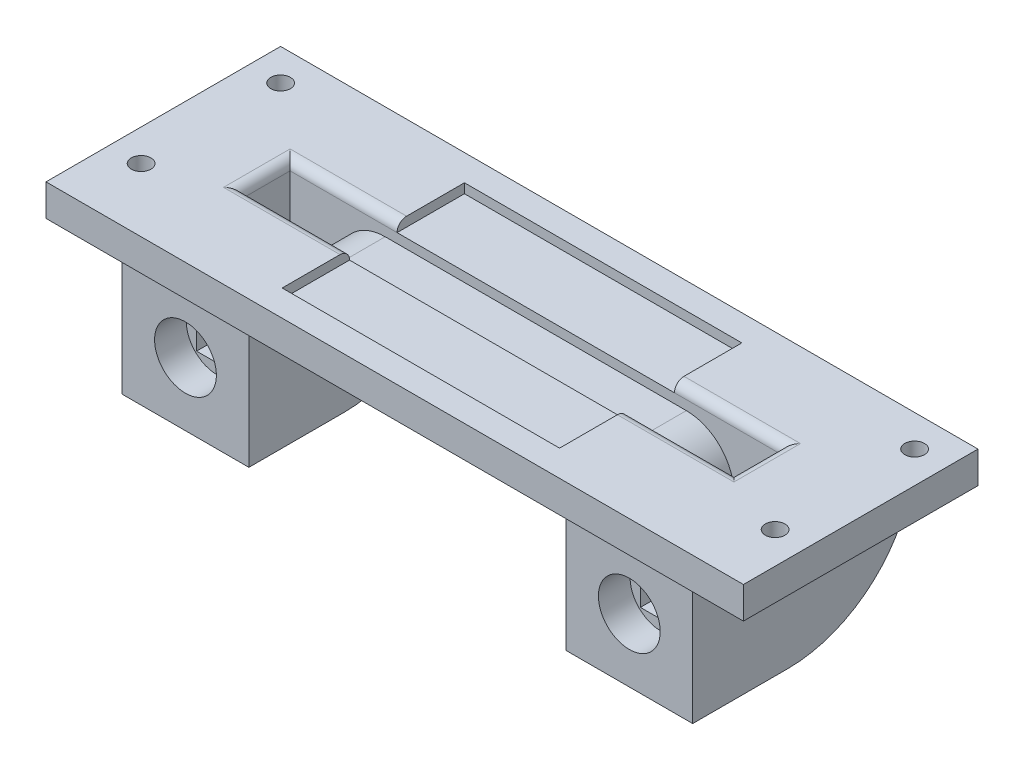
from build123d import *

# Parameters (mm, degrees)
SKETCH1_W           = 110
SKETCH1_H           = 37
SKETCH1_R           = 1.55
BOSS_EXTRUDE1_DEPTH = 5
SKETCH2_W           = 43.75
SKETCH2_H           = 28.75
CUT_EXTRUDE1_DEPTH  = 1.5
SKETCH3_W           = 20
SKETCH3_H           = 35
BOSS_EXTRUDE2_DEPTH = 20
FILLET1_R           = 20
SKETCH4_W           = 7.5
SKETCH4_H           = 7.5
CUT_EXTRUDE2_DEPTH  = 18.75
SKETCH5_W           = 6.5
SKETCH5_H           = 6.5
CUT_EXTRUDE3_DEPTH  = 15
FILLET2_R           = 7.5
CHAMFER1_SIZE       = 0.5
SKETCH7_R           = 4.875
CUT_EXTRUDE5_DEPTH  = 5
SKETCH8_R           = 2.75
CUT_EXTRUDE6_DEPTH  = 2
SKETCH9_W           = 62.5
SKETCH9_H           = 7.5
CUT_EXTRUDE7_DEPTH  = 3
FILLET3_R           = 7.5
FILLET4_R           = 1.5


with BuildPart() as part:
    # Sketch1 → Boss-Extrude1 (new body)
    with BuildSketch(Plane(origin=(0, 0, 0), x_dir=(1, 0, 0), z_dir=(0, 1, 0))):
        Rectangle(SKETCH1_W, SKETCH1_H)
        with Locations(Location((50, -8.5, 0), (0, 0, 270))):
            Circle(SKETCH1_R, mode=Mode.SUBTRACT)
        with Locations(Location((50, 13.5, 0), (0, 0, 270))):
            Circle(SKETCH1_R, mode=Mode.SUBTRACT)
        with Locations(Location((-50, 13.5, 0), (0, 0, 270))):
            Circle(SKETCH1_R, mode=Mode.SUBTRACT)
        with Locations(Location((-50, -8.5, 0), (0, 0, 270))):
            Circle(SKETCH1_R, mode=Mode.SUBTRACT)
    extrude(amount=BOSS_EXTRUDE1_DEPTH)

    # Sketch2 → Cut-Extrude1 (cut)
    with BuildSketch(Plane(origin=(0, 5, 0), x_dir=(1, 0, 0), z_dir=(0, 1, 0))):
        Rectangle(SKETCH2_W, SKETCH2_H)
    extrude(amount=-CUT_EXTRUDE1_DEPTH, mode=Mode.SUBTRACT)

    # Sketch3 → Boss-Extrude2 (add)
    with BuildSketch(Plane(origin=(0, 0, 0), x_dir=(-1, 0, 0), z_dir=(0, -1, 0))):
        with Locations((35, 1)):
            Rectangle(SKETCH3_W, SKETCH3_H)
        with Locations((-35, 1)):
            Rectangle(SKETCH3_W, SKETCH3_H)
    extrude(amount=BOSS_EXTRUDE2_DEPTH)

    # Fillet1
    fillet1_edges = [part.edges().sort_by_distance(p)[0] for p in [
        (35, -20, -18.5),
        (-35, -20, -18.5),
    ]]
    fillet(fillet1_edges, radius=FILLET1_R)

    # Sketch4 → Cut-Extrude2 (cut)
    with BuildSketch(Plane(origin=(0, 5, 0), x_dir=(1, 0, 0), z_dir=(0, 1, 0))):
        with Locations((-35, 0)):
            Rectangle(SKETCH4_W, SKETCH4_H)
        with Locations((35, 0)):
            Rectangle(SKETCH4_W, SKETCH4_H)
    extrude(amount=-CUT_EXTRUDE2_DEPTH, mode=Mode.SUBTRACT)

    # Sketch5 → Cut-Extrude3 (cut)
    with BuildSketch(Plane.XY.offset(16.5)):
        with Locations((-35, -10)):
            Rectangle(SKETCH5_W, SKETCH5_H)
        with Locations((35, -10)):
            Rectangle(SKETCH5_W, SKETCH5_H)
    extrude(amount=-CUT_EXTRUDE3_DEPTH, mode=Mode.SUBTRACT)

    # Fillet2
    fillet2_edges = [part.edges().sort_by_distance(p)[0] for p in [
        (35, -6.75, 3.75),
        (35, -13.75, -3.75),
        (-35, -13.75, -3.75),
        (-35, -6.75, 3.75),
    ]]
    fillet(fillet2_edges, radius=FILLET2_R - 0.0001)  # a hair under: the kernel refuses the full size

    # Chamfer1
    chamfer1_edges = [part.edges().sort_by_distance(p)[0] for p in [
        (-38.25, -6.25005, 3.75),
        (-35, -13.25, 3.75),
        (-31.75, -6.25005, 3.75),
        (31.75, -6.25005, 3.75),
        (35, -13.25, 3.75),
        (38.25, -6.25005, 3.75),
    ]]
    chamfer(chamfer1_edges, length=CHAMFER1_SIZE - 0.0001)  # a hair under: the kernel refuses the full size

    # Sketch7 → Cut-Extrude5 (cut)
    with BuildSketch(Plane.XY.offset(16.5)):
        with Locations((-35, -10)):
            Circle(SKETCH7_R)
        with Locations((35, -10)):
            Circle(SKETCH7_R)
    extrude(amount=-CUT_EXTRUDE5_DEPTH, mode=Mode.SUBTRACT)

    # Sketch8 → Cut-Extrude6 (cut)
    with BuildSketch(Plane.XZ):
        with Locations(Location((-50, 8.5, 0), (0, 0, 270))):
            Circle(SKETCH8_R)
        with Locations(Location((-50, -13.5, 0), (0, 0, 270))):
            Circle(SKETCH8_R)
        with Locations(Location((50, -13.5, 0), (0, 0, 270))):
            Circle(SKETCH8_R)
        with Locations(Location((50, 8.5, 0), (0, 0, 270))):
            Circle(SKETCH8_R)
    extrude(amount=-CUT_EXTRUDE6_DEPTH, mode=Mode.SUBTRACT)

    # Sketch9 → Cut-Extrude7 (cut)
    with BuildSketch(Plane(origin=(0, 5, 0), x_dir=(1, 0, 0), z_dir=(0, 1, 0))):
        Rectangle(SKETCH9_W, SKETCH9_H)
    extrude(amount=-CUT_EXTRUDE7_DEPTH, mode=Mode.SUBTRACT)

    # Fillet3
    fillet3_edges = [part.edges().sort_by_distance(p)[0] for p in [
        (-31.25, 2, 0),
        (31.25, 2, 0),
    ]]
    fillet(fillet3_edges, radius=FILLET3_R)

    # Fillet4
    fillet4_edges = [part.edges().sort_by_distance(p)[0] for p in [
        (-38.75, 5, 0),
        (-30.3125, 5, -3.75),
        (-30.3125, 5, 3.75),
        (38.75, 5, 0),
        (30.3125, 5, 3.75),
        (30.3125, 5, -3.75),
    ]]
    fillet(fillet4_edges, radius=FILLET4_R)


solid = part.part
